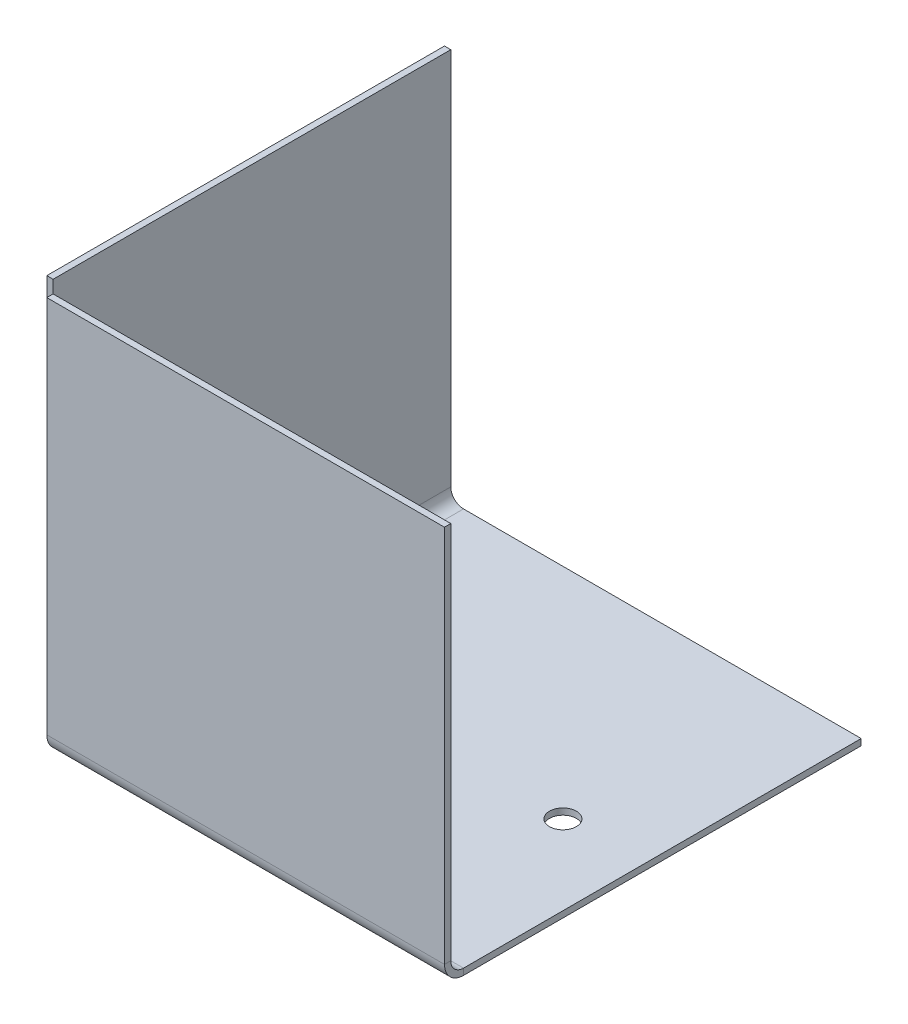
from build123d import *

# Parameters (mm, degrees)
SKETCH1_W               = 100
SKETCH1_H               = 100
BASE_FLANGE1_DEPTH      = 1.5875
EDGE_FLANGE1_DEPTH      = 100
EDGE_FLANGE2_DEPTH      = 100
F_1_4_CLEARANCE_HOLE1_D = 6.7564


# Sheet-metal steps are written as plain solids
with BuildPart() as part:
    # Sketch1 → Base-Flange1 (new body)
    with BuildSketch(Plane(origin=(0, 0, 0), x_dir=(1, 0, 0), z_dir=(0, 1, 0))):
        Rectangle(SKETCH1_W, SKETCH1_H)
    extrude(amount=-BASE_FLANGE1_DEPTH)

    # Edge-Flange1 section (across the edge) → Edge-Flange1 (add)
    with BuildSketch(Plane(origin=(-53.2, 0, -50), x_dir=(1, 0, 0), z_dir=(0, 0, 1))):
        with BuildLine():
            Line((-1.5875, 3.2), (-1.5875, 98.4125))
            Line((-1.5875, 98.4125), (0, 98.4125))
            Line((0, 98.4125), (0, 3.2))
            ThreePointArc((0, 3.2), (0.9372583, 0.9372583), (3.2, 0))
            Line((3.2, 0), (3.2, -1.5875))
            ThreePointArc((3.2, -1.5875), (-0.185273715, -0.185273715), (-1.5875, 3.2))
        make_face()
    extrude(amount=EDGE_FLANGE1_DEPTH)

    # Edge-Flange2 section (across the edge) → Edge-Flange2 (add)
    with BuildSketch(Plane(origin=(-50, 0, 53.2), x_dir=(0, 0, -1), z_dir=(1, 0, 0))):
        with BuildLine():
            Line((-1.5875, 3.2), (-1.5875, 98.4125))
            Line((-1.5875, 98.4125), (0, 98.4125))
            Line((0, 98.4125), (0, 3.2))
            ThreePointArc((0, 3.2), (0.9372583, 0.9372583), (3.2, 0))
            Line((3.2, 0), (3.2, -1.5875))
            ThreePointArc((3.2, -1.5875), (-0.185273715, -0.185273715), (-1.5875, 3.2))
        make_face()
    extrude(amount=EDGE_FLANGE2_DEPTH)

    # 1/4 Clearance Hole1 (through all)
    with Locations(Plane(origin=(0, 0, 0), x_dir=(1, 0, 0), z_dir=(0, 1, 0))):
        with Locations((-30, -5), (30, -5)):
            Hole(F_1_4_CLEARANCE_HOLE1_D / 2)


solid = part.part
